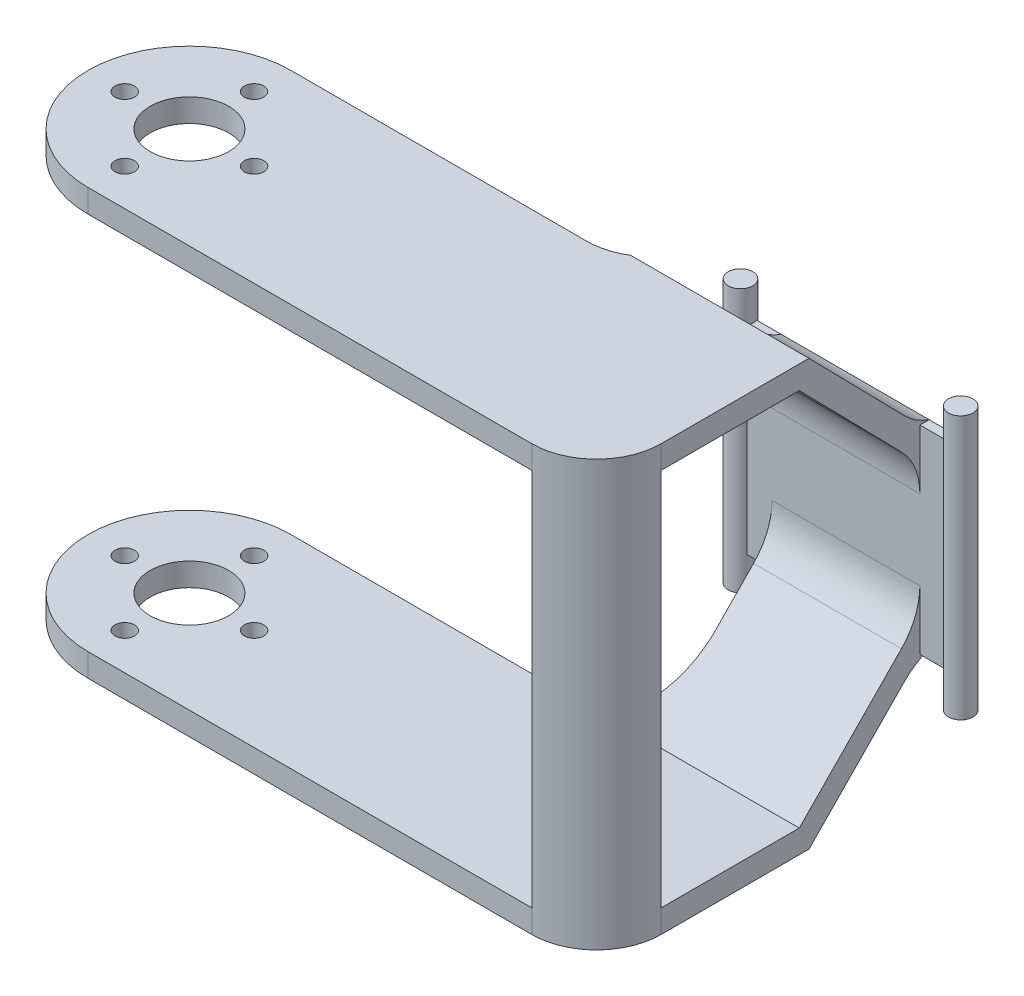
from build123d import *

# Parameters (mm, degrees)
SKETCH1_W           = 23.83
SKETCH1_H           = 1
BOSS_EXTRUDE1_DEPTH = 21.5
SKETCH2_R           = 1.325
BOSS_EXTRUDE2_DEPTH = 14.25
BOSS_EXTRUDE4_DEPTH = 8
SKETCH5_W           = 21.949336604
SKETCH5_H           = 2.5
BOSS_EXTRUDE5_DEPTH = 50
SKETCH6_R           = 4.25
SKETCH6_R_2         = 1.05
CUT_EXTRUDE1_DEPTH  = 83.099025573
FILLET1_R           = 7
FILLET2_R           = 7
FILLET3_R           = 7
BOSS_EXTRUDE6_START = 41
BOSS_EXTRUDE6_DEPTH = 41


with BuildPart() as part:
    # Sketch1 → Boss-Extrude1 (new body)
    with BuildSketch(Plane(origin=(0, 0, 0), x_dir=(1, 0, 0), z_dir=(0, 1, 0))):
        Rectangle(SKETCH1_W, SKETCH1_H)
    extrude(amount=BOSS_EXTRUDE1_DEPTH)

    # Sketch2 → Boss-Extrude2 (add, symmetric)
    with BuildSketch(Plane(origin=(0, 10.75, 0), x_dir=(1, 0, 0), z_dir=(0, 1, 0))):
        with Locations(Location((-11.915, 0, 0), (0, 0, 270))):
            Circle(SKETCH2_R)
        with Locations(Location((11.915, 0, 0), (0, 0, 270))):
            Circle(SKETCH2_R)
    extrude(amount=BOSS_EXTRUDE2_DEPTH, both=True)

    # Sketch4 → Boss-Extrude4 (add, symmetric)
    with BuildSketch(Plane(origin=(0, 0, 0), x_dir=(0, 0, -1), z_dir=(1, 0, 0))):
        Polygon((-0.5, 17.927447783), (-0.5, 21.5), (-12.5, 33.75), (-35.5, 33.75), (-35.5, 31.25), (-13.550663396, 31.25), align=None)
        Polygon((-0.5, 0), (-0.5, 3.572552217), (-13.550663396, -9.75), (-35.5, -9.75), (-35.5, -12.25), (-12.5, -12.25), align=None)
    extrude(amount=BOSS_EXTRUDE4_DEPTH, both=True)

    # Sketch5 → Boss-Extrude5 (add)
    with BuildSketch(Plane.ZY.offset(8)):
        with Locations((24.525331698, 32.5)):
            Rectangle(SKETCH5_W, SKETCH5_H)
        with Locations((24.525331698, -11)):
            Rectangle(SKETCH5_W, SKETCH5_H)
    extrude(amount=BOSS_EXTRUDE5_DEPTH)

    # Sketch6 → Cut-Extrude1 (cut, through all)
    with BuildSketch(Plane(origin=(0, 33.75, 0), x_dir=(1, 0, 0), z_dir=(0, 1, 0))):
        with Locations(Location((-47.025331698, -24.525331698, 0), (0, 0, 270))):
            Circle(SKETCH6_R)
        with Locations(Location((-54.025331698, -24.525331698, 0), (0, 0, 270))):
            Circle(SKETCH6_R_2)
        with Locations(Location((-47.025331698, -17.525331698, 0), (0, 0, 270))):
            Circle(SKETCH6_R_2)
        with Locations(Location((-40.025331698, -24.525331698, 0), (0, 0, 270))):
            Circle(SKETCH6_R_2)
        with Locations(Location((-47.025331698, -31.525331698, 0), (0, 0, 270))):
            Circle(SKETCH6_R_2)
        with BuildLine():
            ThreePointArc((-58, -24.525331743), (-54.785594092, -16.765069336), (-47.025331698, -13.550663396))
            Line((-47.025331698, -13.550663396), (-58, -13.550663396))
            Line((-58, -13.550663396), (-58, -24.525331743))
        make_face()
        with BuildLine():
            ThreePointArc((-47.025331698, -35.5), (-54.78559406, -32.285594092), (-58, -24.525331743))
            Line((-58, -24.525331743), (-58, -35.5))
            Line((-58, -35.5), (-47.025331698, -35.5))
        make_face()
    extrude(amount=-CUT_EXTRUDE1_DEPTH, mode=Mode.SUBTRACT)

    # Fillet1
    # the kernel refuses this fillet: 7 mm, written as the material it adds along each edge
    with BuildSketch(Plane(origin=(-8, -12.25, 13.550663396), x_dir=(-1, 0, 0), z_dir=(0, 1, 0))) as fillet1_piece_1_section:
        with BuildLine():
            CenterArc((FILLET1_R, -FILLET1_R), FILLET1_R, 90, 90)
            Line((0, -FILLET1_R), (0, 0))
            Line((0, 0), (FILLET1_R, 0))
        make_face()
    fillet1_piece_1 = extrude(amount=2.5, mode=Mode.PRIVATE)
    fillet1_piece_1 = split(fillet1_piece_1, bisect_by=Plane(origin=(-10.015975833, -11.661011889, 11.923032054), z_dir=(0, 0.699779834816443, 0.7143585813751185)), keep=Keep.TOP, mode=Mode.PRIVATE)
    fillet1_piece_1 = split(fillet1_piece_1, bisect_by=Plane(origin=(-10.015975833, -9.911562302, 13.708928508), z_dir=(0, -0.699779834816443, -0.7143585813751185)), keep=Keep.TOP, mode=Mode.PRIVATE)
    add(fillet1_piece_1)
    with BuildSketch(Plane(origin=(-8, -12.25, 13.550663396), x_dir=(-1, 0, 0), z_dir=(0, 1, 0))) as fillet1_piece_2_section:
        with BuildLine():
            CenterArc((FILLET1_R, -FILLET1_R), FILLET1_R, 90, 90)
            Line((0, -FILLET1_R), (0, 0))
            Line((0, 0), (FILLET1_R, 0))
        make_face()
    fillet1_piece_2 = extrude(amount=20, mode=Mode.PRIVATE)
    fillet1_piece_2 = split(fillet1_piece_2, bisect_by=Plane(origin=(-8.812454151, -9.294822672, 9.605132414), z_dir=(0, 0.699779834816443, 0.7143585813751185)), keep=Keep.TOP, mode=Mode.PRIVATE)
    fillet1_piece_2 = split(fillet1_piece_2, bisect_by=Plane(origin=(-8.812454151, -9.75, 10.768831879), z_dir=(0, 1, 0)), keep=Keep.TOP, mode=Mode.PRIVATE)
    fillet1_piece_2 = split(fillet1_piece_2, bisect_by=Plane(origin=(-8.812454151, -7.545373085, 11.391028867), z_dir=(0, -0.699779834816443, -0.7143585813751185)), keep=Keep.TOP, mode=Mode.PRIVATE)
    add(fillet1_piece_2)
    with BuildSketch(Plane(origin=(-8, 33.75, 13.550663396), x_dir=(0, 0, -1), z_dir=(0, -1, 0))) as fillet1_piece_3_section:
        with BuildLine():
            CenterArc((FILLET1_R, -FILLET1_R), FILLET1_R, 90, 90)
            Line((0, -FILLET1_R), (0, 0))
            Line((0, 0), (FILLET1_R, 0))
        make_face()
    fillet1_piece_3 = extrude(amount=2.5, mode=Mode.PRIVATE)
    fillet1_piece_3 = split(fillet1_piece_3, bisect_by=Plane(origin=(-10.015975833, 31.411562301, 13.708928507), z_dir=(0, 0.6997798348164432, -0.7143585813751182)), keep=Keep.TOP, mode=Mode.PRIVATE)
    fillet1_piece_3 = split(fillet1_piece_3, bisect_by=Plane(origin=(-10.015975833, 33.161011889, 11.923032054), z_dir=(0, -0.699779834816443, 0.7143585813751185)), keep=Keep.TOP, mode=Mode.PRIVATE)
    add(fillet1_piece_3)
    with BuildSketch(Plane(origin=(-8, 33.75, 13.550663396), x_dir=(0, 0, -1), z_dir=(0, -1, 0))) as fillet1_piece_4_section:
        with BuildLine():
            CenterArc((FILLET1_R, -FILLET1_R), FILLET1_R, 90, 90)
            Line((0, -FILLET1_R), (0, 0))
            Line((0, 0), (FILLET1_R, 0))
        make_face()
    fillet1_piece_4 = extrude(amount=20, mode=Mode.PRIVATE)
    fillet1_piece_4 = split(fillet1_piece_4, bisect_by=Plane(origin=(-8.812454159, 29.045373088, 11.39102887), z_dir=(0, 0.6997798348164432, -0.7143585813751182)), keep=Keep.TOP, mode=Mode.PRIVATE)
    fillet1_piece_4 = split(fillet1_piece_4, bisect_by=Plane(origin=(-8.812454159, 30.794822675, 9.605132416), z_dir=(0, -0.699779834816443, 0.7143585813751185)), keep=Keep.TOP, mode=Mode.PRIVATE)
    fillet1_piece_4 = split(fillet1_piece_4, bisect_by=Plane(origin=(-8.812454159, 31.25, 10.768831882), z_dir=(0, -1, 0)), keep=Keep.TOP, mode=Mode.PRIVATE)
    add(fillet1_piece_4)
    # the kernel refuses this fillet: 7 mm, written as the material it takes off along each edge
    with BuildSketch(Plane(origin=(8, 7.75, 35.5), x_dir=(0, 0, -1), z_dir=(0, -1, 0))) as fillet1_2_piece_1:
        with BuildLine():
            CenterArc((FILLET1_R, -FILLET1_R), FILLET1_R, 90, 90)
            Line((0, -FILLET1_R), (0, 0))
            Line((0, 0), (FILLET1_R, 0))
        make_face()
    extrude(amount=37.5, mode=Mode.SUBTRACT)
    with BuildSketch(Plane(origin=(8, 51.25, 35.5), x_dir=(-1, 0, 0), z_dir=(0, -1, 0))) as fillet1_2_piece_2:
        with BuildLine():
            CenterArc((FILLET1_R, FILLET1_R), FILLET1_R, 180, 90)
            Line((0, FILLET1_R), (0, 0))
            Line((0, 0), (FILLET1_R, 0))
        make_face()
    extrude(amount=37.5, mode=Mode.SUBTRACT)

    # Fillet2
    fillet2_edges = [part.edges().sort_by_distance(p)[0] for p in [
        (0, 17.927447783, 0.5),
        (0, 3.572552217, 0.5),
    ]]
    fillet(fillet2_edges, radius=FILLET2_R)

    # Fillet3
    # the kernel refuses this fillet: 7 mm, written as the material it adds along each edge
    with BuildSketch(Plane(origin=(-8, 21.5, 0.5), x_dir=(0, 0.7143585813744706, 0.6997798348171044), z_dir=(1, 0, 0))) as fillet3_piece_1:
        with BuildLine():
            CenterArc((2.380920079, -7), FILLET3_R, 90, 26.110260914)
            Line((-0.699779835, -0.714358581), (0, 0))
            Line((0, 0), (2.380920079, 0))
        make_face()
    extrude(amount=16)
    with BuildSketch(Plane(origin=(8, 0, 0.5), x_dir=(0, 0, -1), z_dir=(-1, 0, 0))) as fillet3_piece_2:
        with BuildLine():
            CenterArc((3.33439021, 6.599289533), FILLET3_R, 224.409342785, 26.110260914)
            Line((-1.666119859, 1.70083069), (0, 0))
            Line((0, 0), (1, 0))
        make_face()
    extrude(amount=16)

    # Sketch8 → Boss-Extrude6 (add)
    with BuildSketch(Plane(origin=(0, -9.75, 0), x_dir=(1, 0, 0), z_dir=(0, 1, 0)).offset(BOSS_EXTRUDE6_START)):
        with BuildLine():
            ThreePointArc((1, -35.5), (5.949747468, -33.449747468), (8, -28.5))
            Line((8, -28.5), (5, -28.5))
            ThreePointArc((5, -28.5), (3.422054899, -30.922054899), (1, -32.5))
            Line((1, -32.5), (1, -35.5))
        make_face()
    extrude(amount=-BOSS_EXTRUDE6_DEPTH)


solid = part.part
